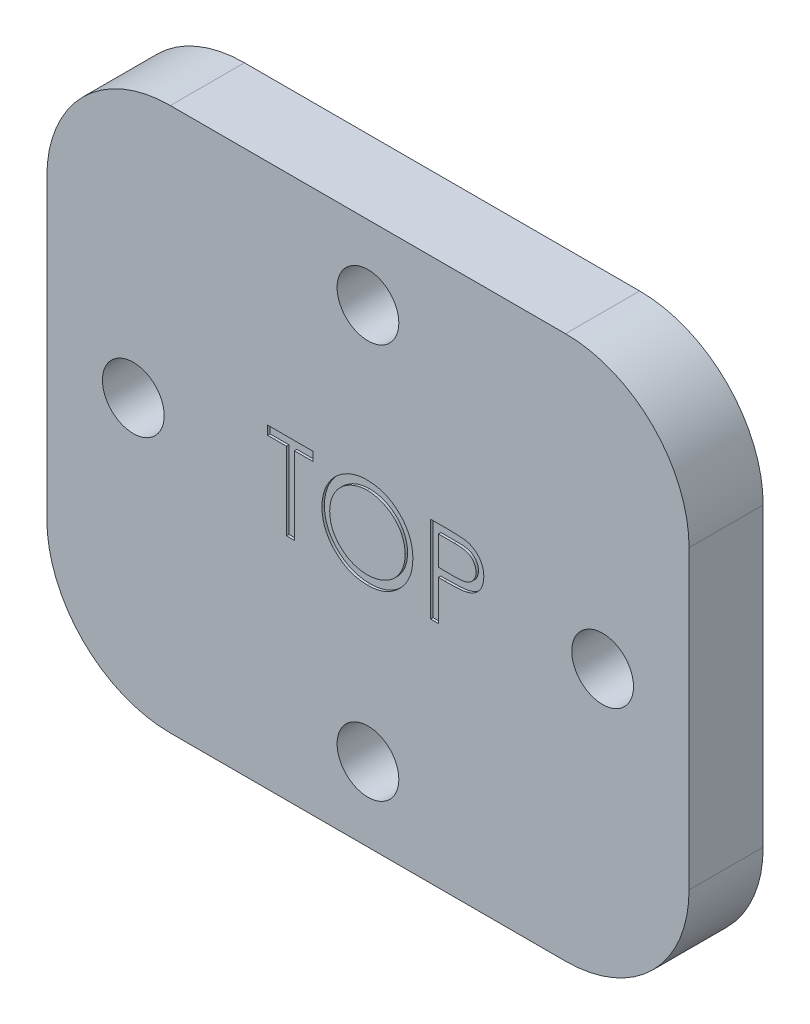
from build123d import *

# Parameters (mm, degrees)
SKETCH1_W           = 26
SKETCH1_H           = 22
SKETCH1_R           = 1.25
BOSS_EXTRUDE1_DEPTH = 3
FILLET1_R           = 5
CUT_EXTRUDE1_DEPTH  = 0.1


with BuildPart() as part:
    # Sketch1 → Boss-Extrude1 (new body)
    with BuildSketch(Plane.XY):
        Rectangle(SKETCH1_W, SKETCH1_H)
        with Locations((0, 8)):
            Circle(SKETCH1_R, mode=Mode.SUBTRACT)
        with Locations((9.5, 0)):
            Circle(SKETCH1_R, mode=Mode.SUBTRACT)
        with Locations((0, -8)):
            Circle(SKETCH1_R, mode=Mode.SUBTRACT)
        with Locations((-9.5, 0)):
            Circle(SKETCH1_R, mode=Mode.SUBTRACT)
    extrude(amount=BOSS_EXTRUDE1_DEPTH)

    # Fillet1
    fillet1_edges = [part.edges().sort_by_distance(p)[0] for p in [
        (-13, -11, 1.5),
        (13, -11, 1.5),
        (13, 11, 1.5),
        (-13, 11, 1.5),
    ]]
    fillet(fillet1_edges, radius=FILLET1_R)

    # Sketch2 → Cut-Extrude1 (cut)
    # profile 1 of 3: a face of its own
    with BuildSketch(Plane.XY.offset(3)):
        Polygon((-4.060442635, 1.407362453), (-4.060442635, 1.766336812), (-2.220699045, 1.766336812), (-2.220699045, 1.407362453), (-2.983519558, 1.407362453), (-2.983519558, -1.733663188), (-3.297622122, -1.733663188), (-3.297622122, 1.407362453), align=None)
    # profile 2 of 3: a face of its own
    with BuildSketch(Plane.XY.offset(3)):
        with BuildLine():
            add(Edge.make_bspline(
                [(-0.044416994, 1.856080401), (0.020391112, 1.854438922), (0.147679579, 1.851214921), (0.334754477, 1.826535818), (0.513349572, 1.783840428), (0.684919711, 1.726977445), (0.847412687, 1.65112306), (1.00205158, 1.559437911), (1.148468454, 1.450961453), (1.284689835, 1.326532226), (1.409346785, 1.191148772), (1.519172672, 1.046670862), (1.611214965, 0.89397206), (1.686800753, 0.733511229), (1.746099362, 0.565651261), (1.787018406, 0.389497258), (1.813156556, 0.206190568), (1.816212334, 0.081163703), (1.817762493, 0.017739055)],
                knots=[0, 0, 0, 0, 1.065120563, 2.091984664, 3.0946048, 4.079830382, 5.057816894, 6.036188127, 7.030412546, 8.04752943, 9.064399622, 10.05169764, 11.02544977, 11.989514704, 12.962713494, 13.945757189, 14.957906945, 16, 16, 16, 16], degree=3))
            add(Edge.make_bspline(
                [(1.817762493, 0.017739055), (1.816212561, -0.045218391), (1.813157464, -0.169314811), (1.786988687, -0.351458256), (1.745947687, -0.526548952), (1.687351421, -0.694294605), (1.612125942, -0.854872169), (1.519470771, -1.007859123), (1.41032956, -1.153305621), (1.286122709, -1.289618286), (1.150721667, -1.414615757), (1.0054914, -1.523534633), (0.85369808, -1.617258757), (0.693388372, -1.692042431), (0.526688335, -1.751814352), (0.352106012, -1.792566982), (0.170459458, -1.818854025), (0.046588454, -1.821872541), (-0.016372122, -1.823406778)],
                knots=[0, 0, 0, 0, 1.043624062, 2.057103931, 3.04512605, 4.022047818, 4.998200453, 5.980619268, 6.982898556, 8.009068085, 9.034988726, 10.034168286, 11.015286542, 11.987931943, 12.962482838, 13.94673481, 14.956375938, 16, 16, 16, 16], degree=3))
            add(Edge.make_bspline(
                [(-0.016372122, -1.823406778), (-0.079796441, -1.821857391), (-0.204822657, -1.818803137), (-0.388359692, -1.792621732), (-0.564637436, -1.751680429), (-0.733151787, -1.693170992), (-0.893996717, -1.617553762), (-1.0474868, -1.525349383), (-1.193005947, -1.415942241), (-1.329347693, -1.291775667), (-1.454096892, -1.156604115), (-1.562856267, -1.01176986), (-1.655081381, -0.860114403), (-1.730444713, -0.701216879), (-1.790109172, -0.535845436), (-1.830813991, -0.362896959), (-1.857149943, -0.183357453), (-1.860184789, -0.061114555), (-1.861724686, 0.000912132)],
                knots=[0, 0, 0, 0, 1.053102029, 2.075944431, 3.073151272, 4.055350789, 5.033113405, 6.020478099, 7.024410459, 8.052272461, 9.079885166, 10.07527673, 11.055994387, 12.023226415, 12.992069828, 13.970394897, 14.97016774, 16, 16, 16, 16], degree=3))
            add(Edge.make_bspline(
                [(-1.861724686, 0.000912132), (-1.861190051, 0.042544801), (-1.860127524, 0.125284925), (-1.847335832, 0.248151525), (-1.828774131, 0.369042183), (-1.802172218, 0.487613131), (-1.767380551, 0.603574115), (-1.726328524, 0.717724878), (-1.676188678, 0.828908602), (-1.61950803, 0.937651994), (-1.556246222, 1.0422599), (-1.486370473, 1.141139483), (-1.412335104, 1.23512048), (-1.331171711, 1.321767483), (-1.245555266, 1.40360114), (-1.154096887, 1.479363857), (-1.057354643, 1.549738808), (-0.954912263, 1.613159149), (-0.849293988, 1.670518283), (-0.740417211, 1.719740134), (-0.629760639, 1.761986196), (-0.516805991, 1.796227021), (-0.401853219, 1.823259057), (-0.284651435, 1.841666411), (-0.165294008, 1.854490729), (-0.084882689, 1.855548231), (-0.044416994, 1.856080401)],
                knots=[0, 0, 0, 0, 1.037015668, 2.060948919, 3.074880161, 4.083647147, 5.086022904, 6.090072063, 7.104153813, 8.122640571, 9.144368836, 10.147691507, 11.138137339, 12.123020368, 13.103399296, 14.087645067, 15.080126199, 16.082011238, 17.087798457, 18.072939717, 19.057185487, 20.037253025, 21.01195951, 21.997135196, 22.992090687, 24, 24, 24, 24], degree=3))
        make_face()
        with BuildLine():
            add(Edge.make_bspline(
                [(-0.028992314, 1.497106043), (-0.062206948, 1.496701152), (-0.128318681, 1.495895243), (-0.226603217, 1.485279527), (-0.323595151, 1.470149638), (-0.419314513, 1.448568117), (-0.513360802, 1.419164064), (-0.606610644, 1.385323156), (-0.698213698, 1.344102066), (-0.787867555, 1.297529361), (-0.874782631, 1.24598044), (-0.956795332, 1.189008673), (-1.034117976, 1.127950119), (-1.106561243, 1.062662282), (-1.173912415, 0.99281268), (-1.237497116, 0.919460244), (-1.294766698, 0.840508353), (-1.347252275, 0.758097946), (-1.394220115, 0.672336365), (-1.43598547, 0.584126503), (-1.470149479, 0.492748816), (-1.498011855, 0.399194658), (-1.521111666, 0.303612199), (-1.53574559, 0.20527635), (-1.546477949, 0.104681238), (-1.547237795, 0.036699384), (-1.547622122, 0.002314376)],
                knots=[0, 0, 0, 0, 1.008559885, 2.007477868, 2.99961109, 3.989939068, 4.984837346, 5.991145699, 7.001802488, 8.033829008, 9.059044045, 10.069351652, 11.065060232, 12.050310815, 13.029377138, 14.011219647, 14.996725999, 15.989392538, 16.977580475, 17.965360261, 18.951710183, 19.937753436, 20.929683414, 21.935841486, 22.955955122, 24, 24, 24, 24], degree=3))
            add(Edge.make_bspline(
                [(-1.547622122, 0.002314376), (-1.54634726, -0.048247845), (-1.543839212, -0.147719375), (-1.521881642, -0.293487519), (-1.488059668, -0.433575805), (-1.438202301, -0.567217715), (-1.375851687, -0.695561998), (-1.298824796, -0.817470102), (-1.207565711, -0.932974977), (-1.103902184, -1.041270246), (-0.990579478, -1.14011605), (-0.870246748, -1.226879458), (-0.74419314, -1.300289708), (-0.612089937, -1.360094781), (-0.474642398, -1.407484518), (-0.330964847, -1.43996315), (-0.182014388, -1.461338605), (-0.080483733, -1.463391361), (-0.028992314, -1.464432419)],
                knots=[0, 0, 0, 0, 1.032063989, 2.030389145, 3.003944642, 3.970395727, 4.937377036, 5.913328081, 6.909231446, 7.93887556, 8.970685674, 9.976071282, 10.964166581, 11.944589148, 12.933237628, 13.927779006, 14.949070134, 16, 16, 16, 16], degree=3))
            add(Edge.make_bspline(
                [(-0.028992314, -1.464432419), (0.005617187, -1.463956915), (0.074258224, -1.463013847), (0.176353746, -1.45351517), (0.276609958, -1.4382833), (0.374886238, -1.416352645), (0.471071049, -1.388905438), (0.565565852, -1.35629771), (0.657364142, -1.315616507), (0.74762398, -1.270668555), (0.834020222, -1.219428398), (0.916495754, -1.164390248), (0.992971734, -1.103421627), (1.065360805, -1.039103815), (1.132988494, -0.970139967), (1.195397479, -0.896619745), (1.252377611, -0.818079088), (1.304843257, -0.735793682), (1.35164652, -0.649797429), (1.392425619, -0.561267751), (1.427021735, -0.470422642), (1.45495024, -0.377131071), (1.476835702, -0.281570222), (1.491915621, -0.183612144), (1.50246406, -0.083452801), (1.503259137, -0.015708945), (1.503659929, 0.018440177)],
                knots=[0, 0, 0, 0, 1.047197238, 2.076906641, 3.100256066, 4.114471768, 5.12198147, 6.126382909, 7.136867548, 8.15857795, 9.17633901, 10.174870724, 11.156907918, 12.133735059, 13.104061851, 14.077631395, 15.04955518, 16.038496417, 17.029181396, 18.010275684, 18.986308667, 19.968651475, 20.955262928, 21.950658345, 22.966943676, 24, 24, 24, 24], degree=3))
            add(Edge.make_bspline(
                [(1.503659929, 0.018440177), (1.503258816, 0.052355681), (1.502463135, 0.119633332), (1.49192066, 0.21909415), (1.47681977, 0.316347361), (1.455057062, 0.411011164), (1.427006908, 0.503109689), (1.392419578, 0.592556437), (1.351634278, 0.679684632), (1.304826054, 0.764278929), (1.25221023, 0.845453667), (1.194715987, 0.92305608), (1.131350639, 0.995628821), (1.063924614, 1.064963515), (0.990753729, 1.129581405), (0.912169435, 1.189503925), (0.829125757, 1.2461772), (0.741198521, 1.297302762), (0.650454568, 1.344516994), (0.55734061, 1.384967997), (0.46291151, 1.419340117), (0.367407398, 1.448657082), (0.270024419, 1.470065112), (0.17142059, 1.485293162), (0.071732332, 1.495891548), (0.004689112, 1.496699926), (-0.028992314, 1.497106043)],
                knots=[0, 0, 0, 0, 1.02996197, 2.043119294, 3.035359645, 4.018872909, 4.991431989, 5.957985074, 6.929999688, 7.912076566, 8.892894881, 9.867085534, 10.843653904, 11.817741046, 12.803660682, 13.806313499, 14.818574707, 15.856120519, 16.894564902, 17.924820532, 18.937903209, 19.946497019, 20.957711757, 21.963978472, 22.977135795, 24, 24, 24, 24], degree=3))
        make_face(mode=Mode.SUBTRACT)
    # profile 3 of 3: a face of its own
    with BuildSketch(Plane.XY.offset(3)):
        with BuildLine():
            Line((2.535711211, 1.766336812), (3.222109448, 1.766336812))
            add(Edge.make_bspline(
                [(3.222109448, 1.766336812), (3.269320355, 1.766284916), (3.359778547, 1.76618548), (3.489493603, 1.763170734), (3.607303335, 1.759144042), (3.712953716, 1.753562149), (3.806769814, 1.746965559), (3.888327113, 1.737713519), (3.95826667, 1.728053224), (4.000173119, 1.718231817), (4.019284929, 1.713752677)],
                knots=[0, 0, 0, 0, 1.415646017, 2.712440637, 3.8905458, 4.950247383, 5.884950622, 6.709939814, 7.411656543, 8, 8, 8, 8], degree=3))
            add(Edge.make_bspline(
                [(4.019284929, 1.713752677), (4.043478463, 1.707130727), (4.09129544, 1.694042866), (4.160196483, 1.667829142), (4.225750329, 1.636746977), (4.288181887, 1.601323037), (4.34672397, 1.560037473), (4.402250011, 1.514563855), (4.454269992, 1.463852287), (4.502491383, 1.408471547), (4.546776181, 1.349351337), (4.584905864, 1.285609107), (4.616833091, 1.218317804), (4.644216362, 1.147524232), (4.663924817, 1.072633909), (4.678771716, 0.994167197), (4.688195344, 0.912132506), (4.689097906, 0.856072639), (4.689557365, 0.827534728)],
                knots=[0, 0, 0, 0, 0.999701418, 1.975846123, 2.934577507, 3.890451536, 4.834027766, 5.787354733, 6.749476667, 7.726910423, 8.712836071, 9.690891519, 10.682875813, 11.679750201, 12.712814741, 13.765529915, 14.8625177, 16, 16, 16, 16], degree=3))
            add(Edge.make_bspline(
                [(4.689557365, 0.827534728), (4.68913594, 0.798756952), (4.688311394, 0.742451288), (4.678415109, 0.660078499), (4.665084917, 0.581360109), (4.644587865, 0.506470659), (4.617742192, 0.435854888), (4.586250139, 0.368433656), (4.548266609, 0.305353985), (4.504621779, 0.246386867), (4.456070185, 0.191476955), (4.402817247, 0.14102216), (4.345077954, 0.095317822), (4.283035806, 0.054261478), (4.216085957, 0.018805199), (4.145243804, -0.012952106), (4.069893587, -0.039623167), (4.017751073, -0.053653228), (3.991240057, -0.060786586)],
                knots=[0, 0, 0, 0, 1.121902311, 2.195077645, 3.232258892, 4.234102512, 5.217864754, 6.176164875, 7.132989551, 8.084763148, 9.034132444, 9.988522005, 10.94243251, 11.903244335, 12.886203696, 13.894208494, 14.929344452, 16, 16, 16, 16], degree=3))
            add(Edge.make_bspline(
                [(3.991240057, -0.060786586), (3.969312723, -0.065449567), (3.921257696, -0.075668761), (3.842114974, -0.087077218), (3.749969588, -0.096814818), (3.644947308, -0.104115956), (3.527142403, -0.110366324), (3.396491146, -0.115334418), (3.252737069, -0.118064272), (3.152465825, -0.118205065), (3.100114256, -0.118278573)],
                knots=[0, 0, 0, 0, 0.601384939, 1.31797006, 2.144135048, 3.087295005, 4.142315834, 5.309527816, 6.595305764, 8, 8, 8, 8], degree=3))
            Line((3.100114256, -0.118278573), (2.849813775, -0.118278573))
            Line((2.849813775, -0.118278573), (2.849813775, -1.733663188))
            Line((2.849813775, -1.733663188), (2.535711211, -1.733663188))
            Line((2.535711211, -1.733663188), (2.535711211, 1.766336812))
        make_face()
        with BuildLine():
            Line((2.849813775, 1.407362453), (2.849813775, 0.240695786))
            Line((2.849813775, 0.240695786), (3.462594224, 0.232983446))
            add(Edge.make_bspline(
                [(3.462594224, 0.232983446), (3.49251415, 0.232967983), (3.55027395, 0.232938131), (3.633710173, 0.236923354), (3.71111946, 0.241523887), (3.782264036, 0.24825981), (3.84717597, 0.257781068), (3.905963499, 0.267392806), (3.958170782, 0.281298168), (4.019269984, 0.300021237), (4.087353331, 0.331953853), (4.16142088, 0.378303743), (4.224191466, 0.437384451), (4.278509763, 0.503812283), (4.321615641, 0.577711412), (4.353171633, 0.656780349), (4.37171279, 0.740208198), (4.374198984, 0.797296337), (4.375454801, 0.826132485)],
                knots=[0, 0, 0, 0, 1.160613943, 2.240541288, 3.23993089, 4.169200891, 5.011653406, 5.7853311, 6.478053781, 7.106038997, 8.262395093, 9.384106736, 10.481365981, 11.59014053, 12.70357646, 13.786202915, 14.881775077, 16, 16, 16, 16], degree=3))
            add(Edge.make_bspline(
                [(4.375454801, 0.826132485), (4.374192154, 0.854270998), (4.37168217, 0.91020688), (4.353026306, 0.992185641), (4.321676993, 1.070421345), (4.278220398, 1.143394431), (4.225479268, 1.209583235), (4.164179925, 1.267080362), (4.094466664, 1.313302065), (4.029618433, 1.343135346), (3.972017247, 1.361350622), (3.921985287, 1.374095462), (3.865494612, 1.384271068), (3.802526833, 1.392510571), (3.733569999, 1.399564032), (3.658031684, 1.40435001), (3.576198041, 1.407151466), (3.51938747, 1.407290421), (3.489937974, 1.407362453)],
                knots=[0, 0, 0, 0, 1.120700087, 2.227813068, 3.331159281, 4.466773991, 5.599788987, 6.693661531, 7.80175334, 8.91857717, 9.525282508, 10.207424825, 10.974604443, 11.810962634, 12.737642355, 13.736264703, 14.826523623, 16, 16, 16, 16], degree=3))
            Line((3.489937974, 1.407362453), (2.849813775, 1.407362453))
        make_face(mode=Mode.SUBTRACT)
    extrude(amount=-CUT_EXTRUDE1_DEPTH, mode=Mode.SUBTRACT)


solid = part.part
